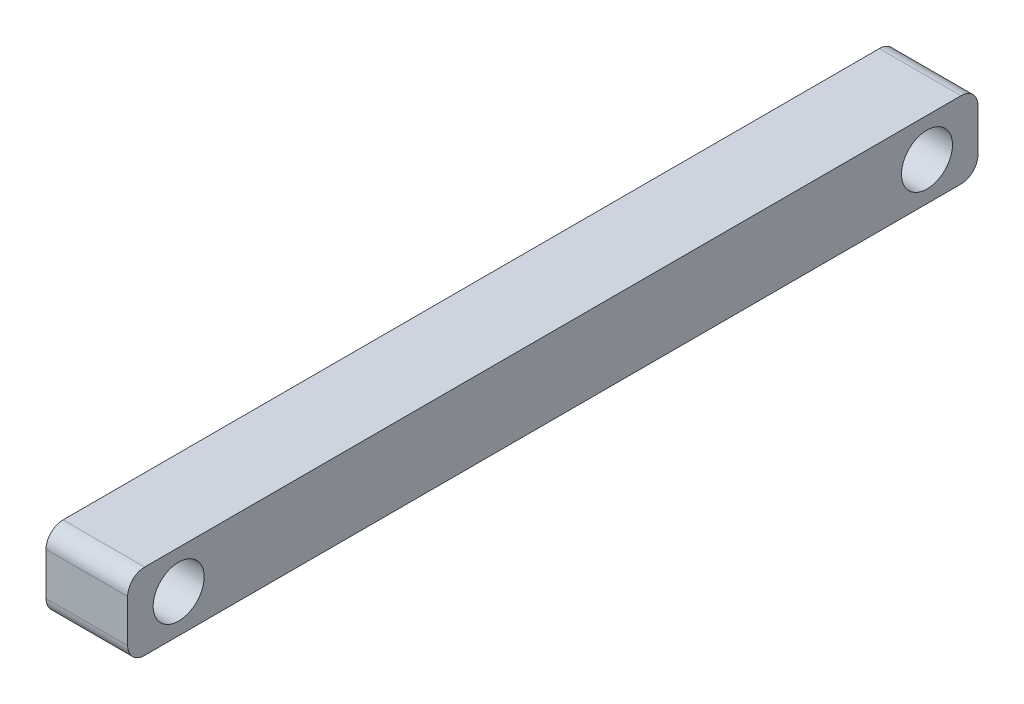
from build123d import *

# Parameters (mm, degrees)
SALIENTE_EXTRUIR1_DEPTH    = 2.4
CORTAR_EXTRUIR1_DEPTH      = 26.215521014
CORTAR_EXTRUIR1_DEPTH_BACK = 26.215521014
CROQUIS2_R                 = 1.5


with BuildPart() as part:
    # Croquis1 → Saliente-Extruir1 (new, symmetric)
    with BuildSketch(Plane(origin=(0, 0, 0), x_dir=(0, 0, -1), z_dir=(1, 0, 0))):
        with BuildLine():
            Line((-24, 2.25), (24, 2.25))
            ThreePointArc((24, 2.25), (24.707106781, 1.957106781), (25, 1.25))
            Line((25, 1.25), (25, -1.25))
            ThreePointArc((25, -1.25), (24.707106781, -1.957106781), (24, -2.25))
            Line((24, -2.25), (-24, -2.25))
            ThreePointArc((-24, -2.25), (-24.707106781, -1.957106781), (-25, -1.25))
            Line((-25, -1.25), (-25, 1.25))
            ThreePointArc((-25, 1.25), (-24.707106781, 1.957106781), (-24, 2.25))
        make_face()
    extrude(amount=SALIENTE_EXTRUIR1_DEPTH, both=True)

    # Croquis2 → Cortar-Extruir1 (cut, two sides: drawn at the far end of the back side and taken through both)
    with BuildSketch(Plane(origin=(0, 0, 0), x_dir=(0, 0, -1), z_dir=(1, 0, 0)).offset(-CORTAR_EXTRUIR1_DEPTH_BACK)):
        with Locations((-22, 0)):
            Circle(CROQUIS2_R)
        with Locations((22, 0)):
            Circle(CROQUIS2_R)
    extrude(amount=CORTAR_EXTRUIR1_DEPTH + CORTAR_EXTRUIR1_DEPTH_BACK, mode=Mode.SUBTRACT)


solid = part.part
